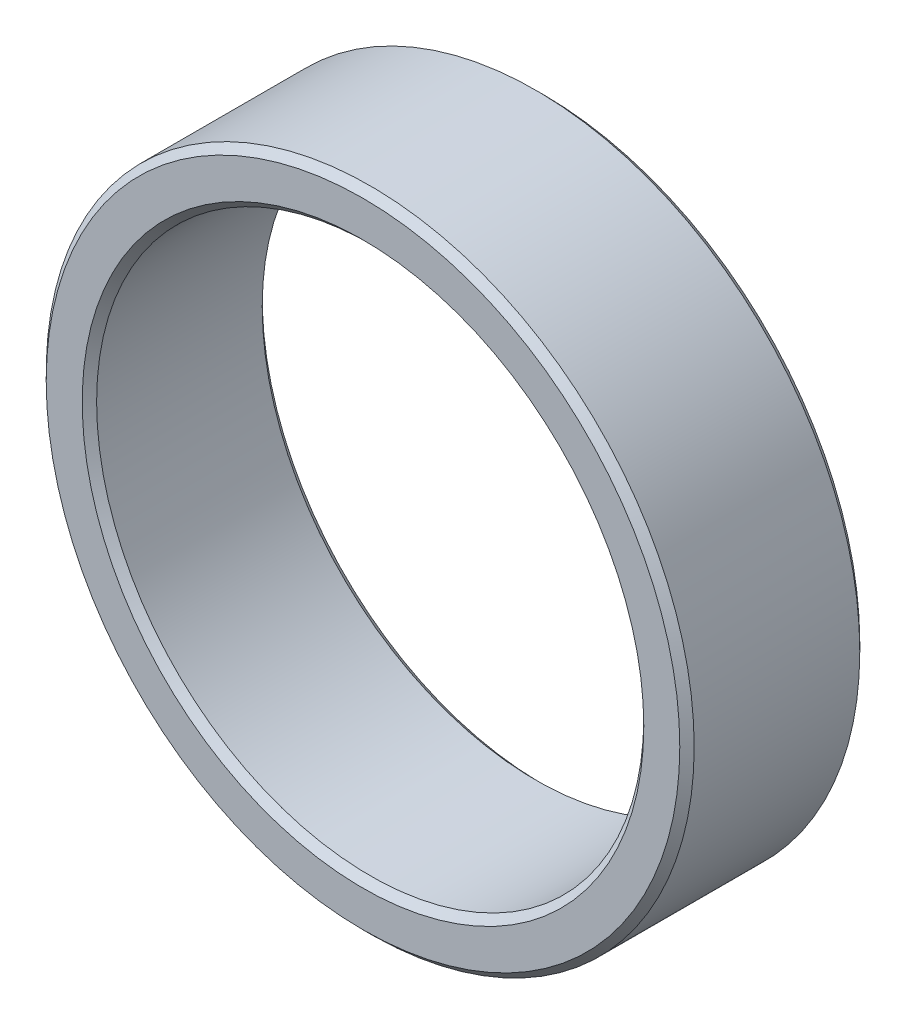
from build123d import *

# Parameters (mm, degrees)
SKETCH1_R           = 9
SKETCH1_R_2         = 7.6
BOSS_EXTRUDE1_DEPTH = 5
CHAMFER1_SIZE       = 0.2


with BuildPart() as part:
    # Sketch1 → Boss-Extrude1 (new body)
    with BuildSketch(Plane.XY):
        Circle(SKETCH1_R)
        Circle(SKETCH1_R_2, mode=Mode.SUBTRACT)
    extrude(amount=BOSS_EXTRUDE1_DEPTH)

    # Chamfer1
    chamfer1_edges = [part.edges().sort_by_distance(p)[0] for p in [
        (-7.6, 0, 0),
        (-9, 0, 0),
        (-9, 0, 5),
        (-7.6, 0, 5),
    ]]
    chamfer(chamfer1_edges, length=CHAMFER1_SIZE)


solid = part.part
